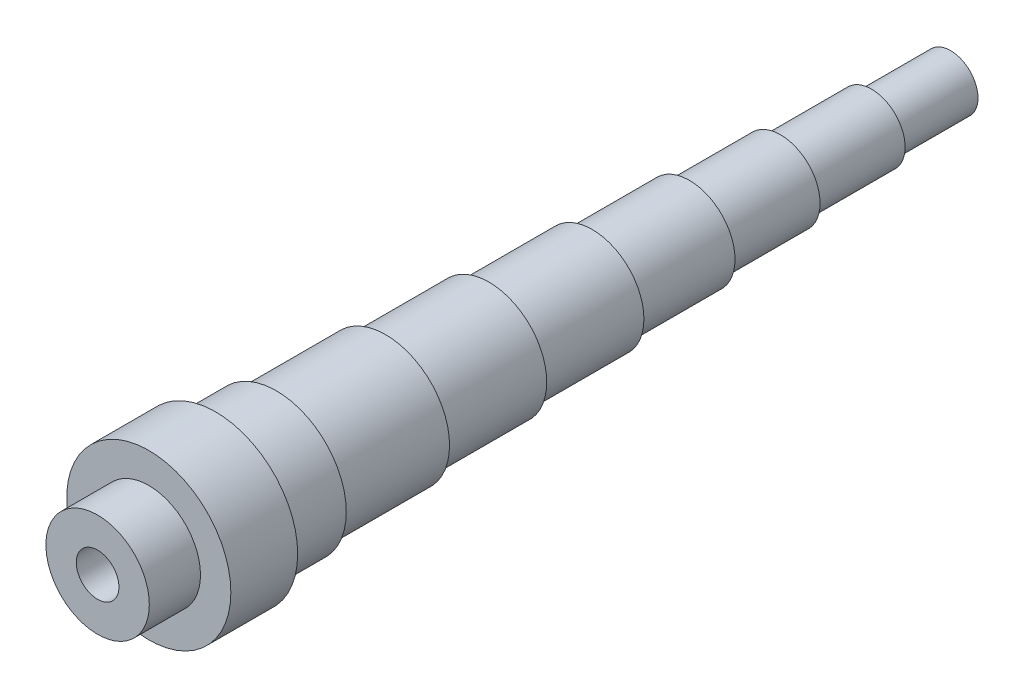
from build123d import *


with BuildPart() as part:
    # Sketch1 → Revolve1 (revolve)
    with BuildSketch(Plane(origin=(0, 0, 0), x_dir=(0, 0, -1), z_dir=(1, 0, 0))):
        Polygon((-264.03808, 12.7), (213.40064, 12.7), (213.40064, 16.31696), (166.38016, 16.31696), (166.38016, 19.93392), (112.12576, 19.93392), (112.12576, 23.55088), (57.87136, 23.55088), (57.87136, 27.16784), (0, 27.16784), (0, 30.7848), (-61.48832, 30.7848), (-61.48832, 34.40176), (-122.97664, 34.40176), (-122.97664, 38.01872), (-188.08192, 38.01872), (-188.08192, 41.63568), (-224.25152, 41.63568), (-224.25152, 48.8696), (-264.03808, 48.8696), (-264.03808, 38.01872), (-264.03808, 30.7848), (-294.51808, 30.7848), (-294.51808, 12.7), align=None)
    revolve(axis=Axis((0, 0, 19.904928919), (0, 0, -1)))


solid = part.part
